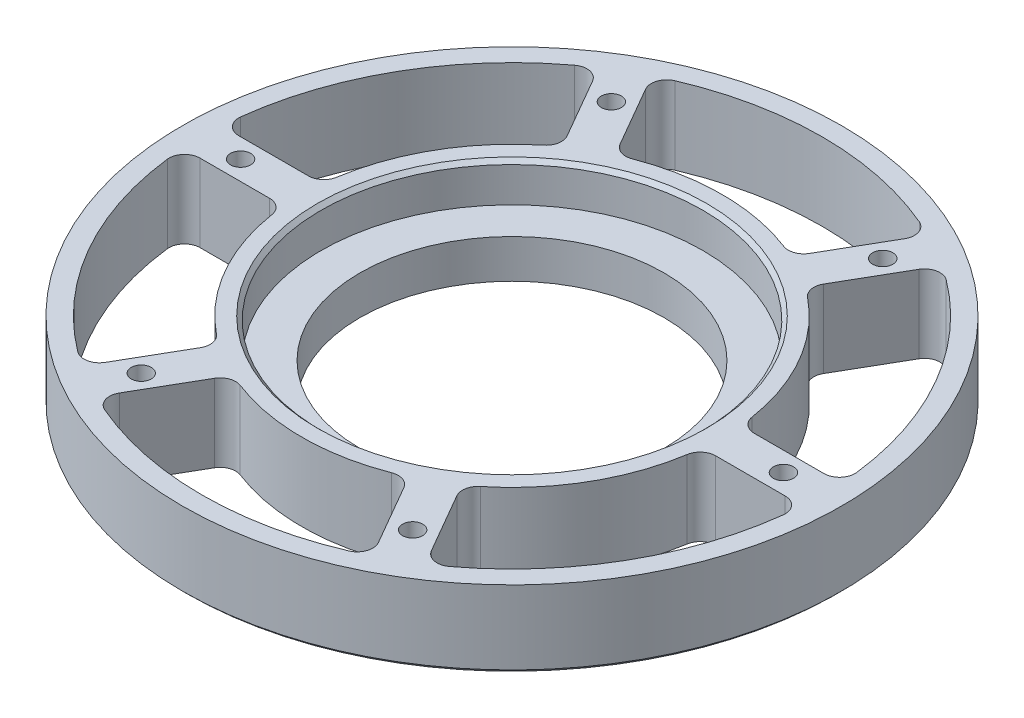
from build123d import *

# Parameters (mm, degrees)
F_6_0_204_DIAMETER_HOLE1_D = 5.1816
CIRPATTERN3_COUNT          = 6
CUT_EXTRUDE1_DEPTH         = 122.86033891327318
FILLET1_R                  = 4
CIRPATTERN4_COUNT          = 6
FILLET1_OF_CIRPATTERN4_R   = 4
CHAMFER1_SIZE              = 1
CHAMFER2_SIZE              = 1


with BuildPart() as part:
    # Sketch2 → Revolve1 (revolve)
    with BuildSketch(Plane(origin=(0, 0, 0), x_dir=(0, 0, -1), z_dir=(1, 0, 0))):
        Polygon((-39.2125, -8.7e-16), (-84.99983, -5.61e-15), (-84.99983, 19.999999999999993), (-49.2125, 19.999999999999993), (-49.21250000000001, 9.999999999999993), (-39.21250000000001, 9.999999999999991), align=None)
    revolve(axis=Axis((0, -0.7500000000000007, 0), (0, 1, 0)))

    # #6 (0.204) Diameter Hole1 (through all)
    with Locations(Plane(origin=(0, 19.999999999999993, 0), x_dir=(1, 0, 0), z_dir=(0, 1, 0))):
        with Locations((-35, 60.621778265)):
            f_6_0_204_diameter_hole1 = Hole(F_6_0_204_DIAMETER_HOLE1_D / 2)

    # CirPattern3: #6 (0.204) Diameter Hole1 ×6 about axis
    cirpattern3_axis = Axis((0, -0.7500000000000007, 0), (0, 1, 0))
    for i in range(1, CIRPATTERN3_COUNT):
        add(f_6_0_204_diameter_hole1.rotate(cirpattern3_axis, i * 360 / CIRPATTERN3_COUNT), mode=Mode.SUBTRACT)

    # Sketch8 → Cut-Extrude1 (cut, through all)
    with BuildSketch(Plane(origin=(0, 19.999999999999993, 0), x_dir=(1, 0, 0), z_dir=(0, 1, 0))):
        with BuildLine():
            Line((-35.59158637125224, 71.64643591698466), (-22.660589701137393, 49.249292691841845))
            ThreePointArc((-22.660589701137393, 49.249292691841845), (3.32e-15, 54.212500000000006), (22.660589701137393, 49.249292691841845))
            Line((22.660589701137393, 49.249292691841845), (35.59158637125224, 71.64643591698466))
            ThreePointArc((35.59158637125224, 71.64643591698466), (4.9e-15, 79.99982999999999), (-35.59158637125224, 71.64643591698466))
        make_face()
    cut_extrude1 = extrude(amount=-CUT_EXTRUDE1_DEPTH, mode=Mode.SUBTRACT)

    # Fillet1
    fillet1_edges = [part.edges().sort_by_distance(p)[0] for p in [
        (35.59158637125225, 9.999999999999996, -71.64643591698467),
        (22.660589701137397, 9.999999999999996, -49.249292691841845),
        (-35.591586371252234, 9.999999999999996, -71.64643591698467),
        (-22.660589701137393, 9.999999999999996, -49.249292691841845),
    ]]
    fillet(fillet1_edges, radius=FILLET1_R)

    # CirPattern4: Cut-Extrude1 ×6 about axis
    cirpattern4_axis = Axis((0, -0.7500000000000007, 0), (0, 1, 0))
    for i in range(1, CIRPATTERN4_COUNT):
        add(cut_extrude1.rotate(cirpattern4_axis, i * 360 / CIRPATTERN4_COUNT), mode=Mode.SUBTRACT)

    # Fillet1 of CirPattern4
    fillet1_of_cirpattern4_edges = [part.edges().sort_by_distance(p)[0] for p in [
        (-44.25184040909643, 9.999999999999996, -66.64643591698479),
        (-31.320843738981637, 9.999999999999996, -44.24929269184193),
        (-79.84342678034868, 9.999999999999996, -4.999999999999904),
        (-53.981433440119034, 9.999999999999996, -4.999999999999929),
        (-79.84342678034868, 9.999999999999996, 4.9999999999998685),
        (-53.981433440119034, 9.999999999999996, 4.999999999999904),
        (-44.25184040909645, 9.999999999999996, 66.64643591698476),
        (-31.32084373898165, 9.999999999999996, 44.249292691841916),
        (-35.591586371252255, 9.999999999999996, 71.64643591698467),
        (-22.660589701137404, 9.999999999999996, 49.249292691841845),
        (35.59158637125223, 9.999999999999996, 71.64643591698467),
        (22.660589701137386, 9.999999999999996, 49.249292691841845),
        (44.2518404090964, 9.999999999999996, 66.64643591698481),
        (31.320843738981612, 9.999999999999996, 44.249292691841944),
        (79.84342678034866, 9.999999999999996, 4.999999999999936),
        (53.98143344011903, 9.999999999999996, 4.999999999999947),
        (79.84342678034868, 9.999999999999996, -4.999999999999893),
        (53.981433440119034, 9.999999999999996, -4.999999999999925),
        (44.25184040909643, 9.999999999999996, -66.64643591698479),
        (31.320843738981637, 9.999999999999996, -44.24929269184193),
    ]]
    fillet(fillet1_of_cirpattern4_edges, radius=FILLET1_OF_CIRPATTERN4_R)

    # Chamfer1
    chamfer1_edges = [part.edges().sort_by_distance(p)[0] for p in [
        (6.03e-15, 19.999999999999993, -49.2125),
    ]]
    chamfer(chamfer1_edges, length=CHAMFER1_SIZE)

    # Chamfer2
    chamfer2_edges = [part.edges().sort_by_distance(p)[0] for p in [
        (1.041e-14, -5.66e-15, -84.99983),
    ]]
    chamfer(chamfer2_edges, length=CHAMFER2_SIZE)


solid = part.part
